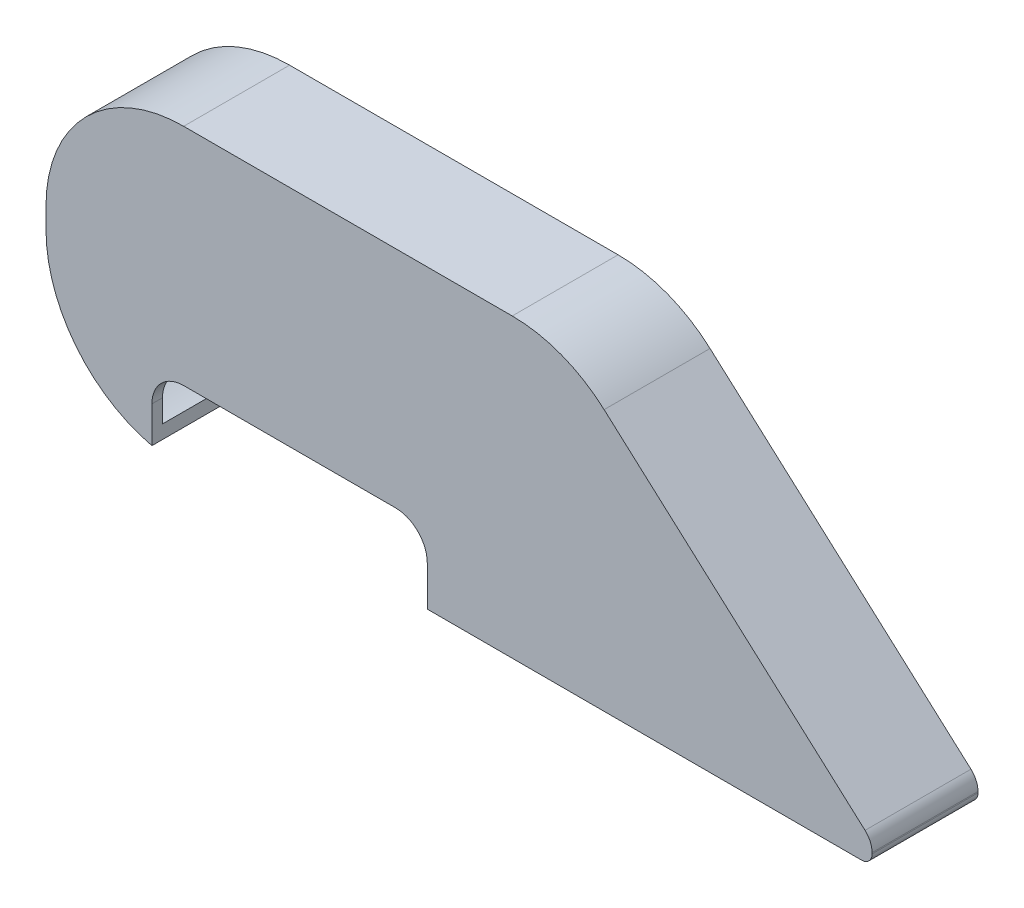
from build123d import *

# Parameters (mm, degrees)
SKETCH1_W               = 80
SKETCH1_H               = 30
BOSS_EXTRUDE1_DEPTH     = 10
CUT_EXTRUDE2_DEPTH      = 87.02325267
CUT_EXTRUDE2_DEPTH_BACK = 10
SKETCH9_OUTSIDE_W       = 99.204
SKETCH9_OUTSIDE_H       = 49.204
CUT_EXTRUDE3_DEPTH      = 10
CUT_EXTRUDE5_DEPTH      = 9
FILLET13_R              = 13
FILLET14_R              = 13
FILLET15_R              = 13
FILLET17_R              = 13
FILLET18_R              = 13
FILLET19_R              = 13
FILLET20_R              = 2
FILLET21_R              = 1
FILLET22_R              = 0.5
FILLET23_R              = 1
SKETCH15_W              = 26
SKETCH15_H              = 7
CUT_EXTRUDE6_DEPTH      = 15
FILLET24_R              = 3
FILLET25_R              = 3


with BuildPart() as part:
    # Sketch1 → Boss-Extrude1 (new body)
    with BuildSketch(Plane.XY):
        with Locations((40, 15)):
            Rectangle(SKETCH1_W, SKETCH1_H)
    extrude(amount=BOSS_EXTRUDE1_DEPTH)

    # Sketch2 → Cut-Extrude2 (cut, two sides: drawn at the far end of the back side and taken through both)
    with BuildSketch(Plane.XY.offset(10).offset(-CUT_EXTRUDE2_DEPTH_BACK)):
        Polygon((50, 30), (80, 3), (80, 30), align=None)
    extrude(amount=CUT_EXTRUDE2_DEPTH + CUT_EXTRUDE2_DEPTH_BACK, mode=Mode.SUBTRACT)

    # Sketch9 outside → Cut-Extrude3 (cut)
    with BuildSketch(Plane.XY.offset(10)):
        with Locations((40, 15)):
            Rectangle(SKETCH9_OUTSIDE_W, SKETCH9_OUTSIDE_H)
        Polygon((1.004393743, 1.037027121), (79.0058654, 0.993658775), (79.0058654, 3), (50, 29.001260854), (1.004393743, 28.998403262), align=None, mode=Mode.SUBTRACT)
    extrude(amount=-CUT_EXTRUDE3_DEPTH, mode=Mode.SUBTRACT)

    # Sketch14 → Cut-Extrude5 (cut)
    with BuildSketch(Plane(origin=(0, 0, 0), x_dir=(-1, 0, 0), z_dir=(0, 0, -1))):
        Polygon((-50, 28.003177056), (-2.012705642, 28.003177056), (-2.00811371, 2.035465522), (-78.002698254, 1.991852338), (-78.002698254, 3), align=None)
    extrude(amount=-CUT_EXTRUDE5_DEPTH, mode=Mode.SUBTRACT)

    # Fillet13
    fillet13_edges = [part.edges().sort_by_distance(p)[0] for p in [
        (2.012705642, 28.003177056, 4.5),
    ]]
    fillet(fillet13_edges, radius=FILLET13_R)

    # Fillet14
    # the kernel refuses this fillet: 13 mm, written as the material it adds along each edge
    with BuildSketch(Plane(origin=(2.00811371, 2.035465522, 0), x_dir=(0.0001768323716472033, 0.999999984365156, 0), z_dir=(0, 0, 1))) as fillet14_piece_1:
        with BuildLine():
            CenterArc((FILLET14_R * 0.999603012675, -FILLET14_R), FILLET14_R, 90, 89.977249786)
            Line((-FILLET14_R * 0.000396908494235, -FILLET14_R * 0.999602933876), (0, 0))
            Line((0, 0), (FILLET14_R * 0.999603012675, 0))
        make_face()
    extrude(amount=9)

    # Fillet15
    fillet15_edges = [part.edges().sort_by_distance(p)[0] for p in [
        (50, 28.003177056, 4.5),
    ]]
    fillet(fillet15_edges, radius=FILLET15_R)

    # Fillet17
    fillet17_edges = [part.edges().sort_by_distance(p)[0] for p in [
        (1.004393743, 28.998403262, 5),
    ]]
    fillet(fillet17_edges, radius=FILLET17_R)

    # Fillet18
    fillet18_edges = [part.edges().sort_by_distance(p)[0] for p in [
        (1.004393743, 1.037027121, 5),
    ]]
    fillet(fillet18_edges, radius=FILLET18_R)

    # Fillet19
    fillet19_edges = [part.edges().sort_by_distance(p)[0] for p in [
        (50, 29.001260854, 5),
    ]]
    fillet(fillet19_edges, radius=FILLET19_R)

    # Fillet20
    fillet20_edges = [part.edges().sort_by_distance(p)[0] for p in [
        (79.0058654, 3, 5),
    ]]
    fillet(fillet20_edges, radius=FILLET20_R)

    # Fillet21
    fillet21_edges = [part.edges().sort_by_distance(p)[0] for p in [
        (79.0058654, 0.993658775, 5),
    ]]
    fillet(fillet21_edges, radius=FILLET21_R)

    # Fillet22
    fillet22_edges = [part.edges().sort_by_distance(p)[0] for p in [
        (78.002698254, 1.991852338, 4.5),
    ]]
    fillet(fillet22_edges, radius=FILLET22_R)

    # Fillet23
    fillet23_edges = [part.edges().sort_by_distance(p)[0] for p in [
        (78.002698254, 3, 4.5),
    ]]
    fillet(fillet23_edges, radius=FILLET23_R)

    # Sketch15 → Cut-Extrude6 (cut)
    with BuildSketch(Plane.XY.offset(10)):
        with Locations((24.004393743, 4.300352014)):
            Rectangle(SKETCH15_W, SKETCH15_H)
    extrude(amount=-CUT_EXTRUDE6_DEPTH, mode=Mode.SUBTRACT)

    # Fillet24
    fillet24_edges = [part.edges().sort_by_distance(p)[0] for p in [
        (11.004393743, 7.800352014, 9.5),
    ]]
    fillet(fillet24_edges, radius=FILLET24_R)

    # Fillet25
    fillet25_edges = [part.edges().sort_by_distance(p)[0] for p in [
        (37.004393743, 7.800352014, 9.5),
    ]]
    fillet(fillet25_edges, radius=FILLET25_R)


solid = part.part
